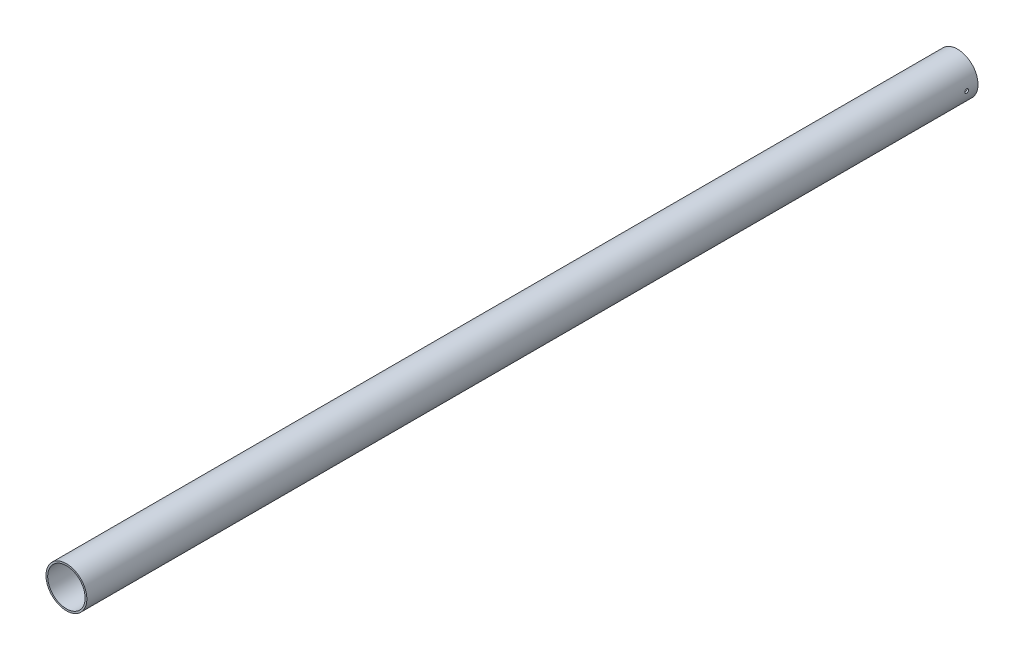
from build123d import *

# Parameters (mm, degrees)
SKETCH1_R           = 12.7
SKETCH1_R_2         = 11.6205
BOSS_EXTRUDE1_DEPTH = 553.63
SKETCH3_W           = 1.2
SKETCH3_H           = 12.7


with BuildPart() as part:
    # Sketch1 → Boss-Extrude1 (new body)
    with BuildSketch(Plane.XY):
        Circle(SKETCH1_R)
        Circle(SKETCH1_R_2, mode=Mode.SUBTRACT)
    extrude(amount=BOSS_EXTRUDE1_DEPTH)

    # Sketch3 → M2 Clearance Hole1 (revolve, cut)
    with BuildSketch(Plane(origin=(0, 0, 7), x_dir=(0, 0, 1), z_dir=(0, 1, 0))):
        with Locations((0.6, 6.35)):
            Rectangle(SKETCH3_W, SKETCH3_H)
    m2_clearance_hole1 = revolve(axis=Axis((-6.35, 0, 7), (1, 0, 0)), mode=Mode.SUBTRACT)

    # Mirror1: M2 Clearance Hole1 across plane
    add(m2_clearance_hole1.mirror(Plane(origin=(0, 0, 0), x_dir=(0, 0, 1), z_dir=(1, 0, 0))), mode=Mode.SUBTRACT)


solid = part.part
